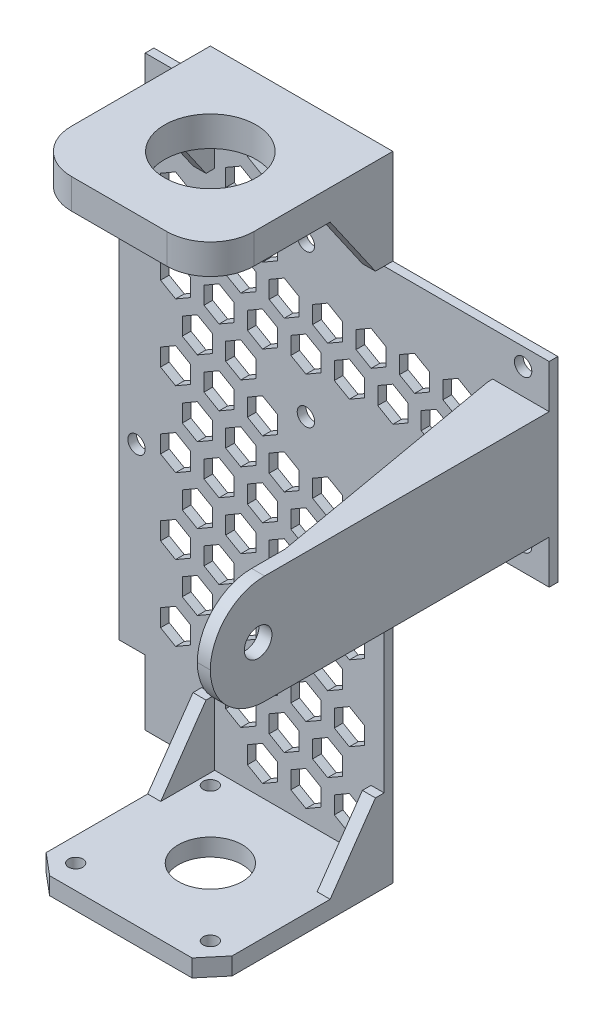
from build123d import *
from OCP.BRepFilletAPI import BRepFilletAPI_MakeChamfer

# Parameters (mm, degrees)
BOSS_EXTRUDE1_DEPTH        = 2
SKETCH3_W                  = 42
SKETCH3_H                  = 42
BOSS_EXTRUDE2_DEPTH        = 4
CUT_EXTRUDE2_REACH         = 159.115
SKETCH4_R                  = 7.354500328
SKETCH5_W                  = 42
SKETCH5_H                  = 42
BOSS_EXTRUDE3_DEPTH        = 6.9
SKETCH6_R                  = 10.55
CUT_EXTRUDE3_DEPTH         = 6.9
SKETCH7_W                  = 80
SKETCH7_H                  = 25
BOSS_EXTRUDE4_DEPTH        = 3
SKETCH8_R                  = 3.177161151
CUT_EXTRUDE4_DEPTH         = 3
FILLET1_R                  = 10
BOSS_EXTRUDE5_DEPTH        = 15
CHAMFER1_SIZE              = 15.290398322
CHAMFER1_SIZE_2            = 22
CHAMFER1_OF_MIRROR1_SIZE   = 15.290398322
CHAMFER1_OF_MIRROR1_SIZE_2 = 22
FILLET2_R                  = 12.5
CHAMFER3_SIZE              = 5
CHAMFER3_SIZE2             = 4.195498156
SKETCH11_W                 = 57.811944789
SKETCH11_H                 = 1.834468822
BOSS_EXTRUDE6_DEPTH        = 10
CHAMFER4_SIZE              = 56.712818196
CHAMFER4_SIZE_2            = 10
SKETCH12_W                 = 2
SKETCH12_H                 = 10
BOSS_EXTRUDE7_DEPTH        = 33
SKETCH14_W                 = 2
SKETCH14_H                 = 105
BOSS_EXTRUDE8_DEPTH        = 6
CUT_EXTRUDE7_REACH         = 126.853
SKETCH13_R                 = 2
SKETCH16_R                 = 1.65
CUT_EXTRUDE8_DEPTH         = 10
FILL_PATTERN1_DEPTH        = 2
SKETCH18_W                 = 2
SKETCH18_H                 = 75
SKETCH18_H_2               = 15
CUT_EXTRUDE9_DEPTH         = 5


# Read off the part's stored shape, not the designer's step: Fill Pattern1
# Some blends are built 0.0001 mm under size
with BuildPart() as part:
    # Sketch1 → Boss-Extrude1 (new body)
    with BuildSketch(Plane.XY):
        Polygon((30, 42.5), (30, 67.5), (-30, 67.5), (-30, -67.5), (30, -67.5), (30, 17.5), (60, 17.5), (60, 42.5), align=None)
    extrude(amount=BOSS_EXTRUDE1_DEPTH)

    # Sketch3 → Boss-Extrude2 (add)
    with BuildSketch(Plane.XZ.offset(67.5)):
        with Locations((4, 21)):
            Rectangle(SKETCH3_W, SKETCH3_H)
    extrude(amount=BOSS_EXTRUDE2_DEPTH)

    # Sketch4 → Cut-Extrude2 (cut, up to next)
    with BuildSketch(Plane.XZ.offset(71.5), mode=Mode.PRIVATE) as cut_extrude2_sk1:
        with Locations((4, 21)):
            Circle(SKETCH4_R)
    cut_extrude2_tool1 = extrude(cut_extrude2_sk1.sketch, amount=-CUT_EXTRUDE2_REACH, mode=Mode.PRIVATE) & part.part
    add(cut_extrude2_tool1.solids().sort_by_distance((4, -71.5, 21))[0], mode=Mode.SUBTRACT)

    # Sketch5 → Boss-Extrude3 (add)
    with BuildSketch(Plane(origin=(0, 67.5, 0), x_dir=(1, 0, 0), z_dir=(0, 1, 0))):
        with Locations((4, -21)):
            Rectangle(SKETCH5_W, SKETCH5_H)
    extrude(amount=BOSS_EXTRUDE3_DEPTH)

    # Sketch6 → Cut-Extrude3 (cut)
    with BuildSketch(Plane(origin=(0, 74.4, 0), x_dir=(1, 0, 0), z_dir=(0, 1, 0))):
        with Locations(Location((4, -21, 0), (0, 0, 180))):
            Circle(SKETCH6_R)
    extrude(amount=-CUT_EXTRUDE3_DEPTH, mode=Mode.SUBTRACT)

    # Sketch7 → Boss-Extrude4 (add)
    with BuildSketch(Plane(origin=(60, 0, 0), x_dir=(0, 0, -1), z_dir=(1, 0, 0))):
        with Locations((-40, 30)):
            Rectangle(SKETCH7_W, SKETCH7_H)
    extrude(amount=BOSS_EXTRUDE4_DEPTH)

    # Sketch8 → Cut-Extrude4 (cut)
    with BuildSketch(Plane(origin=(63, 0, 0), x_dir=(0, 0, -1), z_dir=(1, 0, 0))):
        with Locations((-69, 30)):
            Circle(SKETCH8_R)
    extrude(amount=-CUT_EXTRUDE4_DEPTH, mode=Mode.SUBTRACT)

    # Fillet1
    fillet1_edges = [part.edges().sort_by_distance(p)[0] for p in [
        (-17, 70.95, 42),
        (25, 70.95, 42),
    ]]
    fillet(fillet1_edges, radius=FILLET1_R)

    # Sketch9 → Boss-Extrude5 (add)
    with BuildSketch(Plane.XZ.offset(-67.5)):
        Polygon((-14, 2), (-14, 19.287200003), (-17, 19.287200003), (-17, 0), (-11, 0), (-11, 2), align=None)
        Polygon((22, 2), (22, 19.287200003), (25, 19.287200003), (25, 0), (19, 0), (19, 2), align=None)
    boss_extrude5 = extrude(amount=BOSS_EXTRUDE5_DEPTH)

    # Chamfer1
    # the kernel refuses this chamfer: 22, 15.290398322 mm, written as the material it takes off along each edge
    with BuildSketch(Plane(origin=(-34.820402221, 52.5, 19.287200003), x_dir=(0, -0.04570842341103158, -0.9989548238180133), z_dir=(1, 0, 0))) as chamfer1_piece_1_section:
        Polygon((CHAMFER1_SIZE * 0.998954823787, CHAMFER1_SIZE * 0.0457084234096), (-CHAMFER1_SIZE_2 * 0.045708423411, CHAMFER1_SIZE_2 * 0.998954823818), (0, 0), align=None)
    chamfer1_piece_1 = extrude(amount=116.640804443, mode=Mode.PRIVATE)
    chamfer1_piece_1 = split(chamfer1_piece_1, bisect_by=Plane(origin=(23.5, 67.5, 13.811046651), z_dir=(0, -1, 0)), keep=Keep.TOP, mode=Mode.PRIVATE)
    add(chamfer1_piece_1, mode=Mode.SUBTRACT)
    with BuildSketch(Plane(origin=(42.820402221, 52.5, 19.287200003), x_dir=(0, 0.9997558278217014, 0.02209716580343358), z_dir=(-1, 0, 0))) as chamfer1_piece_2_section:
        Polygon((CHAMFER1_SIZE_2 * 0.999755827822, CHAMFER1_SIZE_2 * 0.0220971658034), (-CHAMFER1_SIZE * 0.0220971658027, CHAMFER1_SIZE * 0.99975582779), (0, 0), align=None)
    chamfer1_piece_2 = extrude(amount=116.640804443, mode=Mode.PRIVATE)
    chamfer1_piece_2 = split(chamfer1_piece_2, bisect_by=Plane(origin=(-15.5, 67.5, 13.811046651), z_dir=(0, -1, 0)), keep=Keep.TOP, mode=Mode.PRIVATE)
    add(chamfer1_piece_2, mode=Mode.SUBTRACT)

    # Mirror1: Boss-Extrude5 across plane
    add(boss_extrude5.mirror(Plane.ZX))

    # Chamfer1 of Mirror1
    # the kernel refuses this chamfer: 22, 15.290398322 mm, written as the material it takes off along each edge
    with BuildSketch(Plane(origin=(-34.820402221, -52.5, 19.287200003), x_dir=(0, 0.04570842341103158, -0.9989548238180133), z_dir=(1, 0, 0))) as chamfer1_of_mirror1_piece_1_section:
        Polygon((CHAMFER1_OF_MIRROR1_SIZE * 0.998954823787, -CHAMFER1_OF_MIRROR1_SIZE * 0.0457084234096), (-CHAMFER1_OF_MIRROR1_SIZE_2 * 0.045708423411, -CHAMFER1_OF_MIRROR1_SIZE_2 * 0.998954823818), (0, 0), align=None)
    chamfer1_of_mirror1_piece_1 = extrude(amount=116.640804443, mode=Mode.PRIVATE)
    chamfer1_of_mirror1_piece_1 = split(chamfer1_of_mirror1_piece_1, bisect_by=Plane(origin=(23.5, -67.5, 13.811046651), z_dir=(0, 1, 0)), keep=Keep.TOP, mode=Mode.PRIVATE)
    add(chamfer1_of_mirror1_piece_1, mode=Mode.SUBTRACT)
    with BuildSketch(Plane(origin=(42.820402221, -52.5, 19.287200003), x_dir=(0, 0.04570842341103158, -0.9989548238180133), z_dir=(-1, 0, 0))) as chamfer1_of_mirror1_piece_2_section:
        Polygon((CHAMFER1_OF_MIRROR1_SIZE * 0.998954823787, CHAMFER1_OF_MIRROR1_SIZE * 0.0457084234096), (-CHAMFER1_OF_MIRROR1_SIZE_2 * 0.045708423411, CHAMFER1_OF_MIRROR1_SIZE_2 * 0.998954823818), (0, 0), align=None)
    chamfer1_of_mirror1_piece_2 = extrude(amount=116.640804443, mode=Mode.PRIVATE)
    chamfer1_of_mirror1_piece_2 = split(chamfer1_of_mirror1_piece_2, bisect_by=Plane(origin=(-15.5, -67.5, 13.811046651), z_dir=(0, 1, 0)), keep=Keep.TOP, mode=Mode.PRIVATE)
    add(chamfer1_of_mirror1_piece_2, mode=Mode.SUBTRACT)

    # Fillet2
    fillet2_edges = [part.edges().sort_by_distance(p)[0] for p in [
        (61.5, 17.5, 80),
        (61.5, 42.5, 80),
    ]]
    fillet(fillet2_edges, radius=FILLET2_R - 0.0001)  # a hair under: the kernel refuses the full size

    # Chamfer3: one chamfer whose edges measure the first distance from different faces: ONE call of the kernel's chamfer builder (chamfer() names one face for all edges)
    chamfer3_edges_1 = [part.edges().sort_by_distance(p)[0] for p in [
        (-17, -69.5, 42),
    ]]
    chamfer3_side_1 = [part.faces().sort_by_distance(p)[0] for p in [
        (4, -69.5, 42),
    ]]
    chamfer3_edges_2 = [part.edges().sort_by_distance(p)[0] for p in [
        (25, -69.5, 42),
    ]]
    chamfer3_side_2 = [part.faces().sort_by_distance(p)[0] for p in [
        (25, -52.960977223, 2.998400841),
    ]]
    chamfer3 = BRepFilletAPI_MakeChamfer(part.part.solid().wrapped)
    for e in chamfer3_edges_1:
        chamfer3.Add(CHAMFER3_SIZE, CHAMFER3_SIZE2, e.wrapped, chamfer3_side_1[0].wrapped)  # the first distance lies on this face
    for e in chamfer3_edges_2:
        chamfer3.Add(CHAMFER3_SIZE, CHAMFER3_SIZE2, e.wrapped, chamfer3_side_2[0].wrapped)  # the first distance lies on this face
    add(Compound.cast(chamfer3.Shape()), mode=Mode.REPLACE)

    # Sketch11 → Boss-Extrude6 (add)
    with BuildSketch(Plane.ZY.offset(-60)):
        with Locations((30.905972395, 41.582765589)):
            Rectangle(SKETCH11_W, SKETCH11_H)
        with Locations((30.905972395, 18.417234411)):
            Rectangle(SKETCH11_W, SKETCH11_H)
    extrude(amount=BOSS_EXTRUDE6_DEPTH)

    # Chamfer4
    chamfer4_edges_1 = [part.edges().sort_by_distance(p)[0] for p in [
        (50, 41.582765589, 59.811944789),
    ]]
    chamfer4_side_1 = [part.faces().sort_by_distance(p)[0] for p in [
        (50, 41.582765589, 59.611944789),
    ]]
    chamfer4_edges_2 = [part.edges().sort_by_distance(p)[0] for p in [
        (50, 18.417234411, 59.811944789),
    ]]
    chamfer4_side_2 = [part.faces().sort_by_distance(p)[0] for p in [
        (50, 18.417234411, 59.611944789),
    ]]
    chamfer4 = BRepFilletAPI_MakeChamfer(part.part.solid().wrapped)
    for e in chamfer4_edges_1:
        chamfer4.Add(CHAMFER4_SIZE - 0.0001, CHAMFER4_SIZE_2 - 0.0001, e.wrapped, chamfer4_side_1[0].wrapped)
    for e in chamfer4_edges_2:
        chamfer4.Add(CHAMFER4_SIZE - 0.0001, CHAMFER4_SIZE_2 - 0.0001, e.wrapped, chamfer4_side_2[0].wrapped)
    add(Compound.cast(chamfer4.Shape()), mode=Mode.REPLACE)  # a hair under: the kernel refuses the full size

    # Sketch12 → Boss-Extrude7 (add)
    with BuildSketch(Plane(origin=(30, 0, 0), x_dir=(0, 0, -1), z_dir=(1, 0, 0))):
        with Locations((-1, 12.5)):
            Rectangle(SKETCH12_W, SKETCH12_H)
        with Locations((-1, 47.5)):
            Rectangle(SKETCH12_W, SKETCH12_H)
    extrude(amount=BOSS_EXTRUDE7_DEPTH)

    # Sketch14 → Boss-Extrude8 (add)
    with BuildSketch(Plane.ZY.offset(30)):
        with Locations((1, 0)):
            Rectangle(SKETCH14_W, SKETCH14_H)
    extrude(amount=BOSS_EXTRUDE8_DEPTH)

    # Sketch13 → Cut-Extrude7 (cut, up to next)
    with BuildSketch(Plane.XY.offset(2), mode=Mode.PRIVATE) as cut_extrude7_sk1:
        with Locations((7, 48.5)):
            Circle(SKETCH13_R)
    cut_extrude7_tool1 = extrude(cut_extrude7_sk1.sketch, amount=-CUT_EXTRUDE7_REACH, mode=Mode.PRIVATE) & part.part
    # Sketch13 → Cut-Extrude7 (cut, up to next)
    with BuildSketch(Plane.XY.offset(2), mode=Mode.PRIVATE) as cut_extrude7_sk2:
        with Locations((7, 13.5)):
            Circle(SKETCH13_R)
    cut_extrude7_tool2 = extrude(cut_extrude7_sk2.sketch, amount=-CUT_EXTRUDE7_REACH, mode=Mode.PRIVATE) & part.part
    # Sketch13 → Cut-Extrude7 (cut, up to next)
    with BuildSketch(Plane.XY.offset(2), mode=Mode.PRIVATE) as cut_extrude7_sk3:
        with Locations((57, 48.5)):
            Circle(SKETCH13_R)
    cut_extrude7_tool3 = extrude(cut_extrude7_sk3.sketch, amount=-CUT_EXTRUDE7_REACH, mode=Mode.PRIVATE) & part.part
    # Sketch13 → Cut-Extrude7 (cut, up to next)
    with BuildSketch(Plane.XY.offset(2), mode=Mode.PRIVATE) as cut_extrude7_sk4:
        with Locations((57, 13.5)):
            Circle(SKETCH13_R)
    cut_extrude7_tool4 = extrude(cut_extrude7_sk4.sketch, amount=-CUT_EXTRUDE7_REACH, mode=Mode.PRIVATE) & part.part
    # Sketch13 → Cut-Extrude7 (cut, up to next)
    with BuildSketch(Plane.XY.offset(2), mode=Mode.PRIVATE) as cut_extrude7_sk5:
        with Locations((-32, 48.5)):
            Circle(SKETCH13_R)
    cut_extrude7_tool5 = extrude(cut_extrude7_sk5.sketch, amount=-CUT_EXTRUDE7_REACH, mode=Mode.PRIVATE) & part.part
    # Sketch13 → Cut-Extrude7 (cut, up to next)
    with BuildSketch(Plane.XY.offset(2), mode=Mode.PRIVATE) as cut_extrude7_sk6:
        with Locations((-32, -11.5)):
            Circle(SKETCH13_R)
    cut_extrude7_tool6 = extrude(cut_extrude7_sk6.sketch, amount=-CUT_EXTRUDE7_REACH, mode=Mode.PRIVATE) & part.part
    add(cut_extrude7_tool1.solids().sort_by_distance((7, 48.5, 2))[0], mode=Mode.SUBTRACT)
    add(cut_extrude7_tool2.solids().sort_by_distance((7, 13.5, 2))[0], mode=Mode.SUBTRACT)
    add(cut_extrude7_tool3.solids().sort_by_distance((57, 48.5, 2))[0], mode=Mode.SUBTRACT)
    add(cut_extrude7_tool4.solids().sort_by_distance((57, 13.5, 2))[0], mode=Mode.SUBTRACT)
    add(cut_extrude7_tool5.solids().sort_by_distance((-32, 48.5, 2))[0], mode=Mode.SUBTRACT)
    add(cut_extrude7_tool6.solids().sort_by_distance((-32, -11.5, 2))[0], mode=Mode.SUBTRACT)

    # Sketch16 → Cut-Extrude8 (cut)
    with BuildSketch(Plane.XZ.offset(71.5)):
        with Locations((-11.5, 36.5)):
            Circle(SKETCH16_R)
        with Locations((19.5, 36.5)):
            Circle(SKETCH16_R)
        with Locations((19.5, 5.5)):
            Circle(SKETCH16_R)
        with Locations((-11.5, 5.5)):
            Circle(SKETCH16_R)
    extrude(amount=-CUT_EXTRUDE8_DEPTH, mode=Mode.SUBTRACT)

    # Fill Pattern1 outline → Fill Pattern1 (cut)
    with BuildSketch(Plane.XY):
        Polygon((-23, -47.301270189), (-19.535898385, -45.301270189), (-19.535898385, -41.301270189), (-23, -39.301270189), (-26.464101615, -41.301270189), (-26.464101615, -45.301270189), align=None)
        Polygon((-8, -38.641016151), (-4.535898385, -36.641016151), (-4.535898385, -32.641016151), (-8, -30.641016151), (-11.464101615, -32.641016151), (-11.464101615, -36.641016151), align=None)
        Polygon((7, -29.980762114), (10.464101615, -27.980762114), (10.464101615, -23.980762114), (7, -21.980762114), (3.535898385, -23.980762114), (3.535898385, -27.980762114), align=None)
        Polygon((-19.535898385, 41.301270189), (-19.535898385, 45.301270189), (-23, 47.301270189), (-26.464101615, 45.301270189), (-26.464101615, 41.301270189), (-23, 39.301270189), align=None)
        Polygon((-19.535898385, 23.980762114), (-19.535898385, 27.980762114), (-23, 29.980762114), (-26.464101615, 27.980762114), (-26.464101615, 23.980762114), (-23, 21.980762114), align=None)
        Polygon((-19.535898385, 6.660254038), (-19.535898385, 10.660254038), (-23, 12.660254038), (-26.464101615, 10.660254038), (-26.464101615, 6.660254038), (-23, 4.660254038), align=None)
        Polygon((-19.535898385, -10.660254038), (-19.535898385, -6.660254038), (-23, -4.660254038), (-26.464101615, -6.660254038), (-26.464101615, -10.660254038), (-23, -12.660254038), align=None)
        Polygon((-19.535898385, -27.980762114), (-19.535898385, -23.980762114), (-23, -21.980762114), (-26.464101615, -23.980762114), (-26.464101615, -27.980762114), (-23, -29.980762114), align=None)
        Polygon((-4.535898385, -49.961524227), (-8, -47.961524227), (-11.464101615, -49.961524227), (-11.464101615, -53.961524227), (-8, -55.961524227), (-4.535898385, -53.961524227), align=None)
        Polygon((10.464101615, -58.621778265), (7, -56.621778265), (3.535898385, -58.621778265), (3.535898385, -62.621778265), (7, -64.621778265), (10.464101615, -62.621778265), align=None)
        Polygon((-3, -47.301270189), (0.464101615, -45.301270189), (0.464101615, -41.301270189), (-3, -39.301270189), (-6.464101615, -41.301270189), (-6.464101615, -45.301270189), align=None)
        Polygon((12, -38.641016151), (15.464101615, -36.641016151), (15.464101615, -32.641016151), (12, -30.641016151), (8.535898385, -32.641016151), (8.535898385, -36.641016151), align=None)
        Polygon((0.464101615, -27.980762114), (0.464101615, -23.980762114), (-3, -21.980762114), (-6.464101615, -23.980762114), (-6.464101615, -27.980762114), (-3, -29.980762114), align=None)
        Polygon((0.464101615, -10.660254038), (0.464101615, -6.660254038), (-3, -4.660254038), (-6.464101615, -6.660254038), (-6.464101615, -10.660254038), (-3, -12.660254038), align=None)
        Polygon((0.464101615, 6.660254038), (0.464101615, 10.660254038), (-3, 12.660254038), (-6.464101615, 10.660254038), (-6.464101615, 6.660254038), (-3, 4.660254038), align=None)
        Polygon((0.464101615, -62.621778265), (0.464101615, -58.621778265), (-3, -56.621778265), (-6.464101615, -58.621778265), (-6.464101615, -62.621778265), (-3, -64.621778265), align=None)
        Polygon((0.464101615, 58.621778265), (0.464101615, 62.621778265), (-3, 64.621778265), (-6.464101615, 62.621778265), (-6.464101615, 58.621778265), (-3, 56.621778265), align=None)
        Polygon((0.464101615, 23.980762114), (0.464101615, 27.980762114), (-3, 29.980762114), (-6.464101615, 27.980762114), (-6.464101615, 23.980762114), (-3, 21.980762114), align=None)
        Polygon((0.464101615, 41.301270189), (0.464101615, 45.301270189), (-3, 47.301270189), (-6.464101615, 45.301270189), (-6.464101615, 41.301270189), (-3, 39.301270189), align=None)
        Polygon((15.464101615, -49.961524227), (12, -47.961524227), (8.535898385, -49.961524227), (8.535898385, -53.961524227), (12, -55.961524227), (15.464101615, -53.961524227), align=None)
        Polygon((-14.535898385, -32.641016151), (-18, -30.641016151), (-21.464101615, -32.641016151), (-21.464101615, -36.641016151), (-18, -38.641016151), (-14.535898385, -36.641016151), align=None)
        Polygon((12, -21.320508076), (15.464101615, -19.320508076), (15.464101615, -15.320508076), (12, -13.320508076), (8.535898385, -15.320508076), (8.535898385, -19.320508076), align=None)
        Polygon((-14.535898385, -15.320508076), (-18, -13.320508076), (-21.464101615, -15.320508076), (-21.464101615, -19.320508076), (-18, -21.320508076), (-14.535898385, -19.320508076), align=None)
        Polygon((12, -4), (15.464101615, -2), (15.464101615, 2), (12, 4), (8.535898385, 2), (8.535898385, -2), align=None)
        Polygon((-14.535898385, 2), (-18, 4), (-21.464101615, 2), (-21.464101615, -2), (-18, -4), (-14.535898385, -2), align=None)
        Polygon((42, 30.641016151), (45.464101615, 32.641016151), (45.464101615, 36.641016151), (42, 38.641016151), (38.535898385, 36.641016151), (38.535898385, 32.641016151), align=None)
        Polygon((27, 21.980762114), (30.464101615, 23.980762114), (30.464101615, 27.980762114), (27, 29.980762114), (23.535898385, 27.980762114), (23.535898385, 23.980762114), align=None)
        Polygon((-14.535898385, 19.320508076), (-18, 21.320508076), (-21.464101615, 19.320508076), (-21.464101615, 15.320508076), (-18, 13.320508076), (-14.535898385, 15.320508076), align=None)
        Polygon((2, -21.320508076), (5.464101615, -19.320508076), (5.464101615, -15.320508076), (2, -13.320508076), (-1.464101615, -15.320508076), (-1.464101615, -19.320508076), align=None)
        Polygon((17, -12.660254038), (20.464101615, -10.660254038), (20.464101615, -6.660254038), (17, -4.660254038), (13.535898385, -6.660254038), (13.535898385, -10.660254038), align=None)
        Polygon((-13, -29.980762114), (-9.535898385, -27.980762114), (-9.535898385, -23.980762114), (-13, -21.980762114), (-16.464101615, -23.980762114), (-16.464101615, -27.980762114), align=None)
        Polygon((5.464101615, -36.641016151), (5.464101615, -32.641016151), (2, -30.641016151), (-1.464101615, -32.641016151), (-1.464101615, -36.641016151), (2, -38.641016151), align=None)
        Polygon((5.464101615, -53.961524227), (5.464101615, -49.961524227), (2, -47.961524227), (-1.464101615, -49.961524227), (-1.464101615, -53.961524227), (2, -55.961524227), align=None)
        Polygon((5.464101615, -2), (5.464101615, 2), (2, 4), (-1.464101615, 2), (-1.464101615, -2), (2, -4), align=None)
        Polygon((5.464101615, 32.641016151), (5.464101615, 36.641016151), (2, 38.641016151), (-1.464101615, 36.641016151), (-1.464101615, 32.641016151), (2, 30.641016151), align=None)
        Polygon((20.464101615, -23.980762114), (17, -21.980762114), (13.535898385, -23.980762114), (13.535898385, -27.980762114), (17, -29.980762114), (20.464101615, -27.980762114), align=None)
        Polygon((-9.535898385, -6.660254038), (-13, -4.660254038), (-16.464101615, -6.660254038), (-16.464101615, -10.660254038), (-13, -12.660254038), (-9.535898385, -10.660254038), align=None)
        Polygon((-13, -47.301270189), (-9.535898385, -45.301270189), (-9.535898385, -41.301270189), (-13, -39.301270189), (-16.464101615, -41.301270189), (-16.464101615, -45.301270189), align=None)
        Polygon((20.464101615, -41.301270189), (17, -39.301270189), (13.535898385, -41.301270189), (13.535898385, -45.301270189), (17, -47.301270189), (20.464101615, -45.301270189), align=None)
        Polygon((20.464101615, -58.621778265), (17, -56.621778265), (13.535898385, -58.621778265), (13.535898385, -62.621778265), (17, -64.621778265), (20.464101615, -62.621778265), align=None)
        Polygon((20.464101615, 58.621778265), (20.464101615, 62.621778265), (17, 64.621778265), (13.535898385, 62.621778265), (13.535898385, 58.621778265), (17, 56.621778265), align=None)
        Polygon((20.464101615, 23.980762114), (20.464101615, 27.980762114), (17, 29.980762114), (13.535898385, 27.980762114), (13.535898385, 23.980762114), (17, 21.980762114), align=None)
        Polygon((-9.535898385, 10.660254038), (-13, 12.660254038), (-16.464101615, 10.660254038), (-16.464101615, 6.660254038), (-13, 4.660254038), (-9.535898385, 6.660254038), align=None)
        Polygon((7, -47.301270189), (10.464101615, -45.301270189), (10.464101615, -41.301270189), (7, -39.301270189), (3.535898385, -41.301270189), (3.535898385, -45.301270189), align=None)
        Polygon((-4.535898385, -19.320508076), (-4.535898385, -15.320508076), (-8, -13.320508076), (-11.464101615, -15.320508076), (-11.464101615, -19.320508076), (-8, -21.320508076), align=None)
        Polygon((-4.535898385, -2), (-4.535898385, 2), (-8, 4), (-11.464101615, 2), (-11.464101615, -2), (-8, -4), align=None)
        Polygon((-4.535898385, 15.320508076), (-4.535898385, 19.320508076), (-8, 21.320508076), (-11.464101615, 19.320508076), (-11.464101615, 15.320508076), (-8, 13.320508076), align=None)
        Polygon((-4.535898385, 49.961524227), (-4.535898385, 53.961524227), (-8, 55.961524227), (-11.464101615, 53.961524227), (-11.464101615, 49.961524227), (-8, 47.961524227), align=None)
        Polygon((-4.535898385, 32.641016151), (-4.535898385, 36.641016151), (-8, 38.641016151), (-11.464101615, 36.641016151), (-11.464101615, 32.641016151), (-8, 30.641016151), align=None)
        Polygon((7, -12.660254038), (10.464101615, -10.660254038), (10.464101615, -6.660254038), (7, -4.660254038), (3.535898385, -6.660254038), (3.535898385, -10.660254038), align=None)
        Polygon((37, 21.980762114), (40.464101615, 23.980762114), (40.464101615, 27.980762114), (37, 29.980762114), (33.535898385, 27.980762114), (33.535898385, 23.980762114), align=None)
        Polygon((7, 21.980762114), (10.464101615, 23.980762114), (10.464101615, 27.980762114), (7, 29.980762114), (3.535898385, 27.980762114), (3.535898385, 23.980762114), align=None)
        Polygon((22, 30.641016151), (25.464101615, 32.641016151), (25.464101615, 36.641016151), (22, 38.641016151), (18.535898385, 36.641016151), (18.535898385, 32.641016151), align=None)
        Polygon((10.464101615, 58.621778265), (10.464101615, 62.621778265), (7, 64.621778265), (3.535898385, 62.621778265), (3.535898385, 58.621778265), (7, 56.621778265), align=None)
        Polygon((15.464101615, 32.641016151), (15.464101615, 36.641016151), (12, 38.641016151), (8.535898385, 36.641016151), (8.535898385, 32.641016151), (12, 30.641016151), align=None)
        Polygon((47, 21.980762114), (50.464101615, 23.980762114), (50.464101615, 27.980762114), (47, 29.980762114), (43.535898385, 27.980762114), (43.535898385, 23.980762114), align=None)
        Polygon((-13, 39.301270189), (-9.535898385, 41.301270189), (-9.535898385, 45.301270189), (-13, 47.301270189), (-16.464101615, 45.301270189), (-16.464101615, 41.301270189), align=None)
        Polygon((-14.535898385, 32.641016151), (-14.535898385, 36.641016151), (-18, 38.641016151), (-21.464101615, 36.641016151), (-21.464101615, 32.641016151), (-18, 30.641016151), align=None)
        Polygon((-9.535898385, 23.980762114), (-9.535898385, 27.980762114), (-13, 29.980762114), (-16.464101615, 27.980762114), (-16.464101615, 23.980762114), (-13, 21.980762114), align=None)
        Polygon((32, 30.641016151), (35.464101615, 32.641016151), (35.464101615, 36.641016151), (32, 38.641016151), (28.535898385, 36.641016151), (28.535898385, 32.641016151), align=None)
    extrude(amount=FILL_PATTERN1_DEPTH, mode=Mode.SUBTRACT)

    # Sketch18 → Cut-Extrude9 (cut)
    with BuildSketch(Plane(origin=(30, 0, 0), x_dir=(0, 0, -1), z_dir=(1, 0, 0))):
        with Locations((-1, -30)):
            Rectangle(SKETCH18_W, SKETCH18_H)
        with Locations((-1, 60)):
            Rectangle(SKETCH18_W, SKETCH18_H_2)
    extrude(amount=-CUT_EXTRUDE9_DEPTH, mode=Mode.SUBTRACT)


solid = part.part
